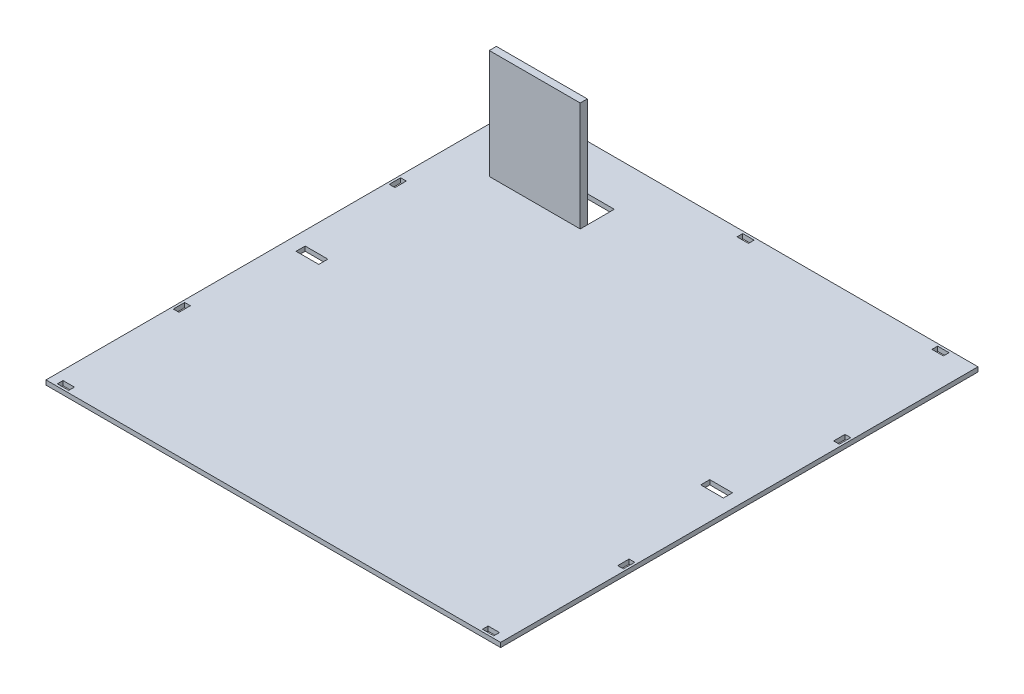
from build123d import *

# Parameters (mm, degrees)
SKETCH1_W           = 200
SKETCH1_H           = 210
SKETCH1_W_2         = 5
SKETCH1_H_2         = 2.5
SKETCH1_W_3         = 2.5
SKETCH1_H_3         = 5
SKETCH1_W_4         = 10
SKETCH1_H_4         = 4
MAINBODY_DEPTH      = 2
SKETCH1_8_W         = 40
SKETCH1_8_H         = 3.124603495
BOSS_EXTRUDE1_DEPTH = 50


with BuildPart() as part:
    # Sketch1 → MainBody (new body)
    with BuildSketch(Plane(origin=(0, 0, 0), x_dir=(1, 0, 0), z_dir=(0, 1, 0))):
        Rectangle(SKETCH1_W, SKETCH1_H)
        with Locations((-93.5, -102.75)):
            Rectangle(SKETCH1_W_2, SKETCH1_H_2, mode=Mode.SUBTRACT)
        with Locations((-97.75, -47.5)):
            Rectangle(SKETCH1_W_3, SKETCH1_H_3, mode=Mode.SUBTRACT)
        with Locations((93.5, -102.75)):
            Rectangle(SKETCH1_W_2, SKETCH1_H_2, mode=Mode.SUBTRACT)
        with Locations((97.75, -47.5)):
            Rectangle(SKETCH1_W_3, SKETCH1_H_3, mode=Mode.SUBTRACT)
        with Locations((-89, 1)):
            Rectangle(SKETCH1_W_4, SKETCH1_H_4, mode=Mode.SUBTRACT)
        with Locations((-97.75, 47.5)):
            Rectangle(SKETCH1_W_3, SKETCH1_H_3, mode=Mode.SUBTRACT)
        Polygon((-80, 70), (-80, 73.124603495), (-80, 85), (-40, 85), (-40, 73.124603495), (-40, 70), align=None, mode=Mode.SUBTRACT)
        with Locations((-83.25, 102.75)):
            Rectangle(SKETCH1_W_2, SKETCH1_H_2, mode=Mode.SUBTRACT)
        with Locations((0, 102.75)):
            Rectangle(SKETCH1_W_2, SKETCH1_H_2, mode=Mode.SUBTRACT)
        with Locations((89, 1)):
            Rectangle(SKETCH1_W_4, SKETCH1_H_4, mode=Mode.SUBTRACT)
        with Locations((97.75, 47.5)):
            Rectangle(SKETCH1_W_3, SKETCH1_H_3, mode=Mode.SUBTRACT)
        with Locations((85.75, 102.75)):
            Rectangle(SKETCH1_W_2, SKETCH1_H_2, mode=Mode.SUBTRACT)
    extrude(amount=MAINBODY_DEPTH)

    # Sketch1<8> → Boss-Extrude1 (add)
    with BuildSketch(Plane(origin=(0, 0, 0), x_dir=(1, 0, 0), z_dir=(0, 1, 0))):
        with Locations((-60, 71.562301748)):
            Rectangle(SKETCH1_8_W, SKETCH1_8_H)
    extrude(amount=BOSS_EXTRUDE1_DEPTH)


solid = part.part
